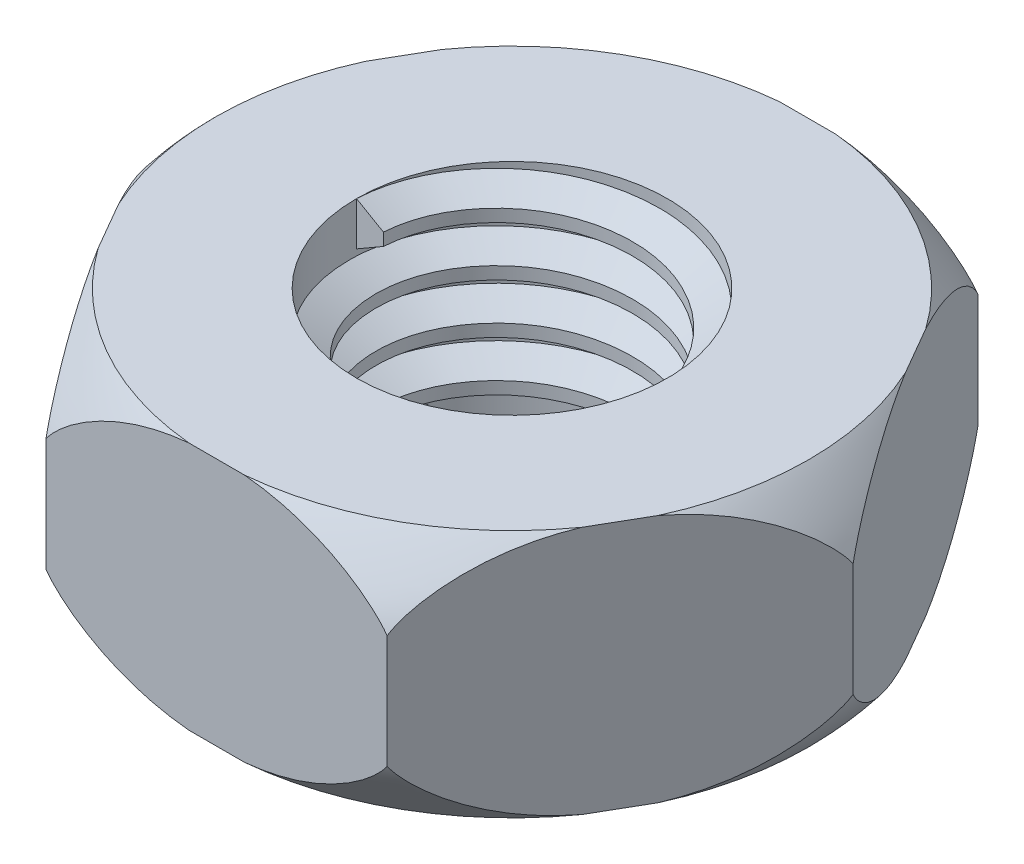
from build123d import *

# Parameters (mm, degrees)
SKETCH1_R           = 2.5
BOSS_EXTRUDE1_DEPTH = 2
THREAD1_PITCH       = 0.8


with BuildPart() as part:
    # Sketch1 → Boss-Extrude1 (new body)
    with BuildSketch(Plane(origin=(0, 0, 0), x_dir=(1, 0, 0), z_dir=(0, 1, 0))):
        Polygon((-5.484827557, 0), (-2.742413779, -4.75), (2.742413779, -4.75), (5.484827557, 0), (2.742413779, 4.75), (-2.742413779, 4.75), align=None)
        with Locations(Location((0, 0, 0), (0, 0, 270))):
            Circle(SKETCH1_R, mode=Mode.SUBTRACT)
    boss_extrude1 = extrude(amount=-BOSS_EXTRUDE1_DEPTH)

    # Sketch2 → Cut-Revolve1 (revolve, cut)
    with BuildSketch(Plane.XY):
        with BuildLine():
            Line((-5.484827557, -0.910278043), (-5.484827557, -2))
            Line((-5.484827557, -2), (-4.771038843, -2))
            add(Edge.make_bspline(
                [(-4.771038843, -2), (-4.976393344, -1.791145905), (-5.342339128, -1.305644769), (-5.484827557, -0.910278043)],
                knots=[0, 0, 0, 0, 0.941596052, 0.941596052, 0.941596052, 0.941596052], degree=3))
        make_face()
    cut_revolve1 = revolve(axis=Axis((0, 0, 0), (0, -1, 0)), mode=Mode.SUBTRACT)

    # Mirror2: Boss-Extrude1, Cut-Revolve1 across plane
    add(boss_extrude1.mirror(Plane.ZX))
    add(cut_revolve1.mirror(Plane.ZX), mode=Mode.SUBTRACT)

    # Thread1: arcs per turn and ends read off the stored shape
    # Thread1: the profile of Thread Profile1 profile screwed along a right-hand helix through 4.0625 turns, 8 arcs to a turn; built about Z, then put on its axis
    thread1_z = Axis((0, 0, 0), (0, 0, 1))
    thread1_corners = [(2.5003, 0, -0.000173205), (2.5003, 0, 0.700173203), (2.0669873, 0, 0.449999999), (2.0669873, 0, 0.249999999)]
    with BuildLine(mode=Mode.PRIVATE) as thread1_profile:
        Line(thread1_corners[0], thread1_corners[1])
        Line(thread1_corners[1], thread1_corners[2])
        Line(thread1_corners[2], thread1_corners[3])
        Line(thread1_corners[3], thread1_corners[0])
    thread1_cap = Face(thread1_profile.wire())
    thread1_turn_angles = [0, 22.5, 45, 67.5, 90, 112.5, 135, 157.5, 180, 202.5, 225, 247.5, 270, 292.5, 315, 337.5, 360]
    thread1_turn_weights = [1, 0.9238795325112867, 1, 0.9238795325112867, 1, 0.9238795325112867, 1, 0.9238795325112867, 1, 0.9238795325112867, 1, 0.9238795325112867, 1, 0.9238795325112867, 1, 0.9238795325112867, 1]
    thread1_turn_rails = [Edge.make_bspline([Vector(p[0], p[1], 0).rotate(thread1_z, thread1_turn_angles[k]) / thread1_turn_weights[k] + Vector(0, 0, p[2] + THREAD1_PITCH * thread1_turn_angles[k] / 360) for k in range(17)], [0, 0, 0, 1, 1, 2, 2, 3, 3, 4, 4, 5, 5, 6, 6, 7, 7, 8, 8, 8], 2, thread1_turn_weights) for p in thread1_corners]
    thread1_turn_sides = [Face.make_surface_from_curves(thread1_turn_rails[p[0]], thread1_turn_rails[p[1]]) for p in [(0, 1), (1, 2), (2, 3), (3, 0)]]
    thread1_last_angles = [1440, 1451.25, 1462.5]
    thread1_last_weights = [1, 0.9807852804032304, 1]
    thread1_last_rails = [Edge.make_bspline([Vector(p[0], p[1], 0).rotate(thread1_z, thread1_last_angles[k]) / thread1_last_weights[k] + Vector(0, 0, p[2] + THREAD1_PITCH * thread1_last_angles[k] / 360) for k in range(3)], [0, 0, 0, 1, 1, 1], 2, thread1_last_weights) for p in thread1_corners]
    thread1_last_sides = [Face.make_surface_from_curves(thread1_last_rails[p[0]], thread1_last_rails[p[1]]) for p in [(0, 1), (1, 2), (2, 3), (3, 0)]]
    thread1 = Plane(origin=(0, 2, 0), x_dir=(-1, 0, 0), z_dir=(0, -1, 0)) * Solid(Shell([*[p.moved(Location((0, 0, THREAD1_PITCH * i))) for i in range(4) for p in thread1_turn_sides], *thread1_last_sides, thread1_cap, thread1_cap.rotate(thread1_z, 1462.5).moved(Location((0, 0, THREAD1_PITCH * 1462.5 / 360)))]))
    add(thread1)


solid = part.part
